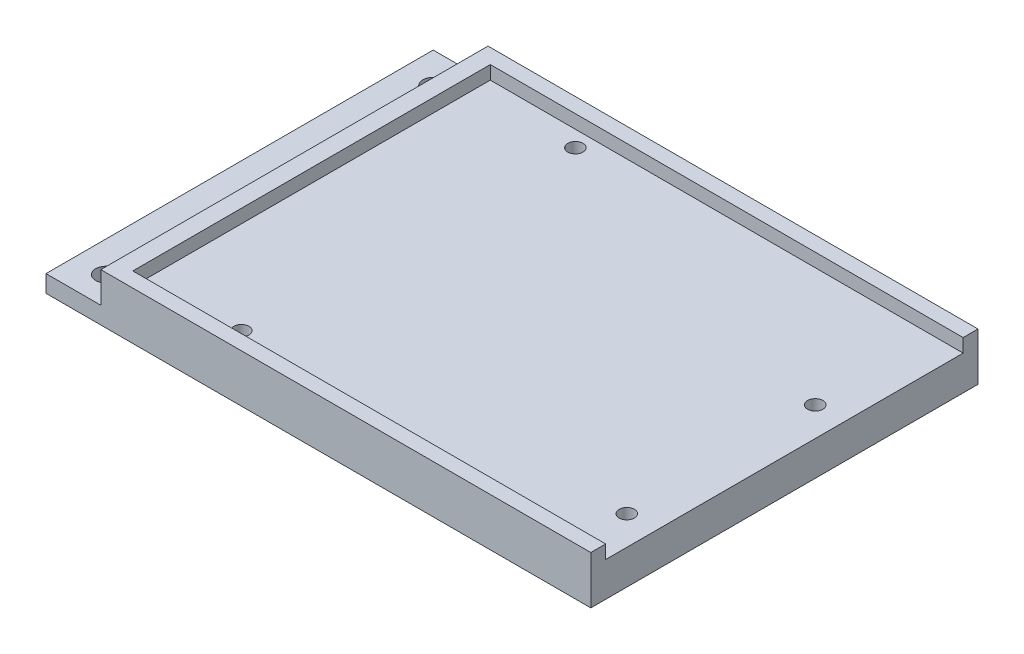
from build123d import *

# Parameters (mm, degrees)
SKETCH1_W               = 80.772
SKETCH1_H               = 57.404
BOSS_EXTRUDE1_DEPTH     = 7.112
CUT_EXTRUDE1_DEPTH      = 71.546642415
CUT_EXTRUDE1_DEPTH_BACK = 71.546642415
SKETCH2_W               = 8.128
SKETCH2_H               = 4.572
CUT_EXTRUDE3_DEPTH      = 51.054114157
CUT_EXTRUDE3_DEPTH_BACK = 51.054114157
SKETCH4_R               = 1.1303
CUT_EXTRUDE2_DEPTH      = 50.756778272
CUT_EXTRUDE2_DEPTH_BACK = 50.756778272
SKETCH3_R               = 1.524
SKETCH5_W               = 70.104
SKETCH5_H               = 52.999999918
CUT_EXTRUDE4_DEPTH      = 2


with BuildPart() as part:
    # Sketch1 → Boss-Extrude1 (new body)
    with BuildSketch(Plane(origin=(0, 0, 0), x_dir=(1, 0, 0), z_dir=(0, 1, 0))):
        Rectangle(SKETCH1_W, SKETCH1_H)
    extrude(amount=BOSS_EXTRUDE1_DEPTH)

    # Sketch2 → Cut-Extrude1 (cut, two sides: drawn at the far end of the back side and taken through both)
    with BuildSketch(Plane.XY.offset(28.702).offset(-CUT_EXTRUDE1_DEPTH_BACK)):
        with Locations((-36.322, 4.826)):
            Rectangle(SKETCH2_W, SKETCH2_H)
    extrude(amount=CUT_EXTRUDE1_DEPTH + CUT_EXTRUDE1_DEPTH_BACK, mode=Mode.SUBTRACT)

    # Sketch4 → Cut-Extrude3 (cut, two sides: drawn at the far end of the back side and taken through both)
    with BuildSketch(Plane(origin=(0, 7.112, 0), x_dir=(1, 0, 0), z_dir=(0, 1, 0)).offset(-CUT_EXTRUDE3_DEPTH_BACK)):
        with Locations((-14.732, 24.13)):
            Circle(SKETCH4_R)
        with Locations((-16.002, -24.13)):
            Circle(SKETCH4_R)
        with Locations((36.068, 8.89)):
            Circle(SKETCH4_R)
        with Locations((36.068, -19.05)):
            Circle(SKETCH4_R)
    extrude(amount=CUT_EXTRUDE3_DEPTH + CUT_EXTRUDE3_DEPTH_BACK, mode=Mode.SUBTRACT)

    # Sketch3 → Cut-Extrude2 (cut, two sides: drawn at the far end of the back side and taken through both)
    with BuildSketch(Plane(origin=(0, 2.54, 0), x_dir=(1, 0, 0), z_dir=(0, 1, 0)).offset(-CUT_EXTRUDE2_DEPTH_BACK)):
        with Locations((-35.814, -24.384)):
            Circle(SKETCH3_R)
        with Locations((-35.814, 24.13)):
            Circle(SKETCH3_R)
    extrude(amount=CUT_EXTRUDE2_DEPTH + CUT_EXTRUDE2_DEPTH_BACK, mode=Mode.SUBTRACT)

    # Sketch5 → Cut-Extrude4 (cut)
    with BuildSketch(Plane(origin=(0, 7.112, 0), x_dir=(1, 0, 0), z_dir=(0, 1, 0))):
        with Locations((5.334, 0)):
            Rectangle(SKETCH5_W, SKETCH5_H)
    extrude(amount=-CUT_EXTRUDE4_DEPTH, mode=Mode.SUBTRACT)


solid = part.part
